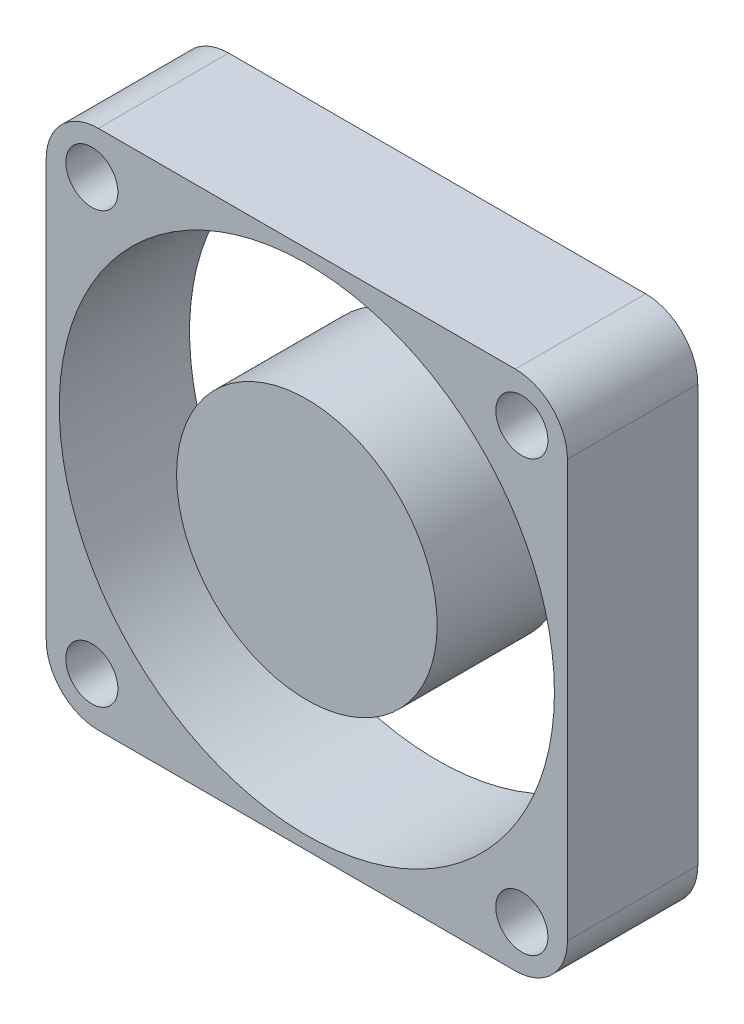
from build123d import *

# Parameters (mm, degrees)
SKETCH1_W             = 40
SKETCH1_H             = 40
SKETCH1_R             = 2
SKETCH1_R_2           = 19
BOSS_EXTRUDE1_DEPTH   = 10
SKETCH1_R_3           = 10
BOSS_EXTRUDE1_2_DEPTH = 10
FILLET1_R             = 4


with BuildPart() as part:
    # Sketch1 → Boss-Extrude1 (new body)
    with BuildSketch(Plane.XY):
        with Locations((20, 20)):
            Rectangle(SKETCH1_W, SKETCH1_H)
        with Locations((3.5, 3.5)):
            Circle(SKETCH1_R, mode=Mode.SUBTRACT)
        with Locations((36.5, 3.5)):
            Circle(SKETCH1_R, mode=Mode.SUBTRACT)
        with Locations((20, 20)):
            Circle(SKETCH1_R_2, mode=Mode.SUBTRACT)
        with Locations((3.5, 36.5)):
            Circle(SKETCH1_R, mode=Mode.SUBTRACT)
        with Locations((36.5, 36.5)):
            Circle(SKETCH1_R, mode=Mode.SUBTRACT)
    extrude(amount=BOSS_EXTRUDE1_DEPTH)

    # Fillet1
    fillet1_edges = [part.edges().sort_by_distance(p)[0] for p in [
        (0, 40, 5),
        (0, 0, 5),
        (40, 0, 5),
        (40, 40, 5),
    ]]
    fillet(fillet1_edges, radius=FILLET1_R)


with BuildPart() as body_2:
    # Sketch1 → Boss-Extrude1 2 (new body)
    with BuildSketch(Plane.XY):
        with Locations((20, 20)):
            Circle(SKETCH1_R_3)
    extrude(amount=BOSS_EXTRUDE1_2_DEPTH)


solid = Compound([part.part, body_2.part])
